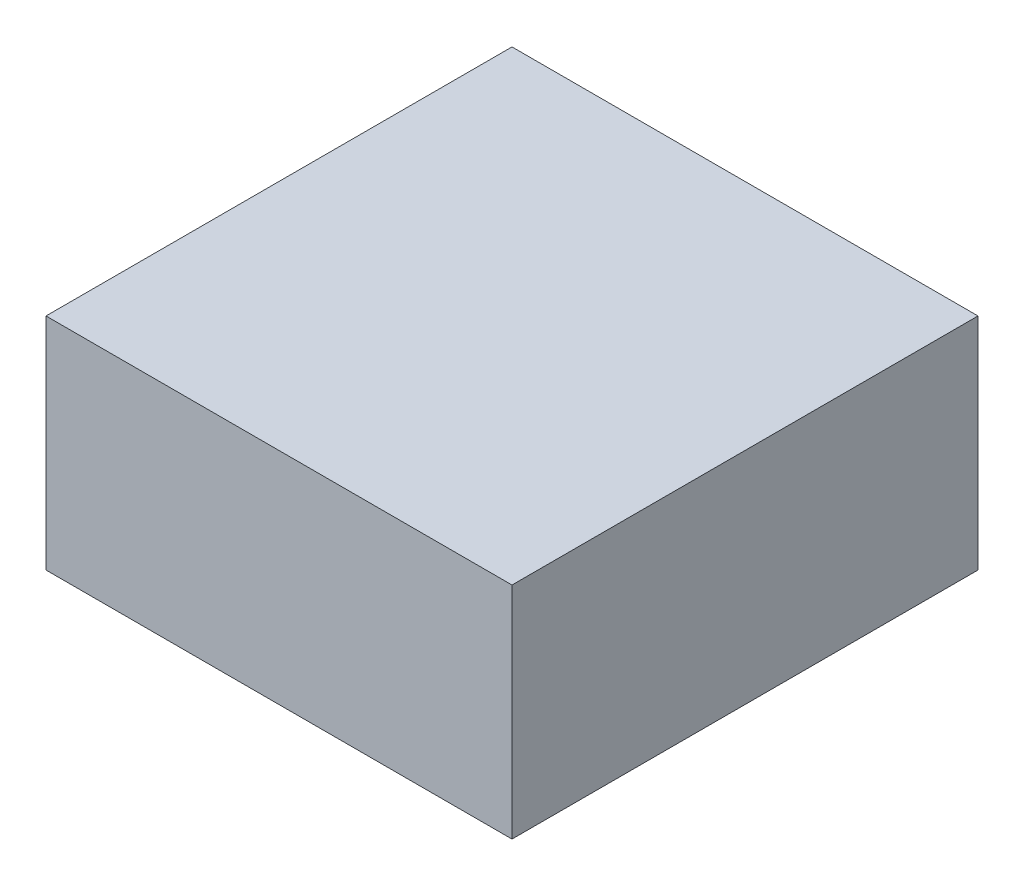
from build123d import *

# Parameters (mm, degrees)
SKETCH1_W           = 18
SKETCH1_H           = 18
BOSS_EXTRUDE1_DEPTH = 8.5


with BuildPart() as part:
    # Sketch1 → Boss-Extrude1 (new body)
    with BuildSketch(Plane(origin=(0, 0, 0), x_dir=(1, 0, 0), z_dir=(0, 1, 0))):
        with Locations((9, 9)):
            Rectangle(SKETCH1_W, SKETCH1_H)
    extrude(amount=BOSS_EXTRUDE1_DEPTH)


solid = part.part
